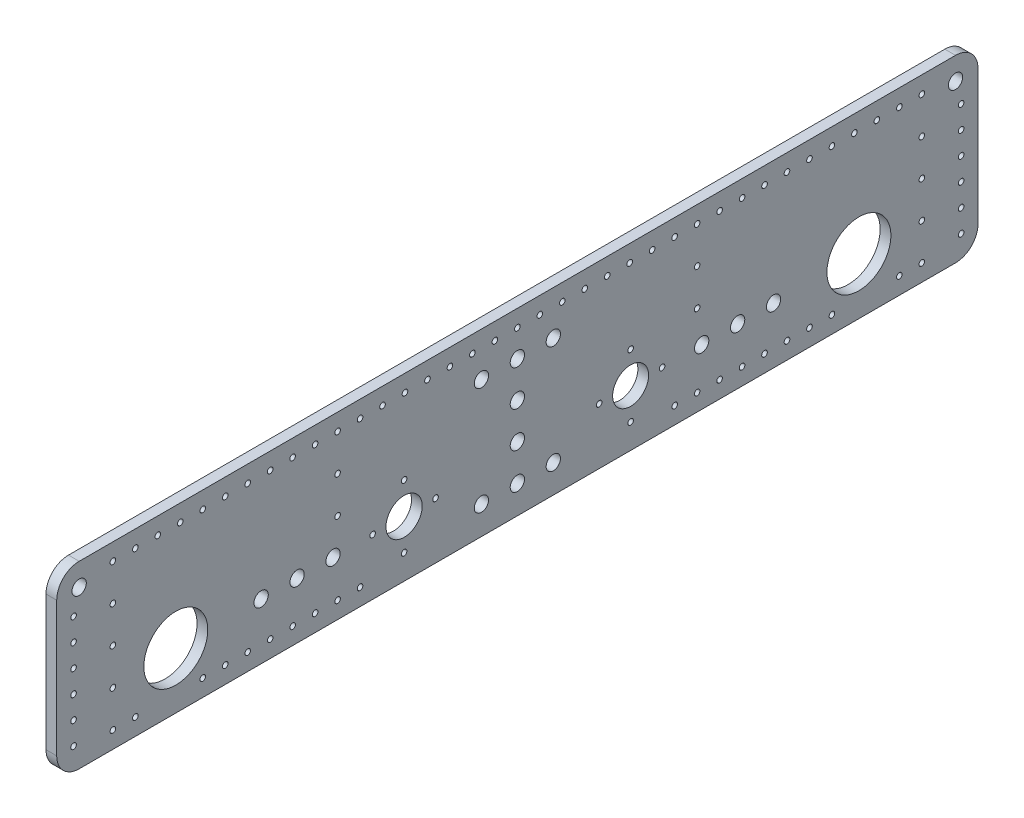
from build123d import *

# Parameters (mm, degrees)
SKETCH2_R           = 14.225
SKETCH2_R_2         = 3.18
SKETCH2_R_3         = 1.25
SKETCH2_R_4         = 8
SKETCH2_R_5         = 8.068284678
BOSS_EXTRUDE1_DEPTH = 4.7625


with BuildPart() as part:
    # Sketch2 → Boss-Extrude1 (new body)
    with BuildSketch(Plane(origin=(0, 0, 0), x_dir=(0, 0, -1), z_dir=(1, 0, 0))):
        with BuildLine():
            Line((-23.472321429, 28.668303571), (-23.472321429, -31.331696429))
            ThreePointArc((-23.472321429, -31.331696429), (-20.54338924, -38.40276424), (-13.472321429, -41.331696429))
            Line((-13.472321429, -41.331696429), (376.527678571, -41.331696429))
            ThreePointArc((376.527678571, -41.331696429), (383.598746383, -38.40276424), (386.527678571, -31.331696429))
            Line((386.527678571, -31.331696429), (386.527678571, 28.668303571))
            ThreePointArc((386.527678571, 28.668303571), (383.598746383, 35.739371383), (376.527678571, 38.668303571))
            Line((376.527678571, 38.668303571), (-13.472321429, 38.668303571))
            ThreePointArc((-13.472321429, 38.668303571), (-20.54338924, 35.739371383), (-23.472321429, 28.668303571))
        make_face()
        with Locations((29.527678571, -16.331696429)):
            Circle(SKETCH2_R, mode=Mode.SUBTRACT)
        with Locations((333.527678571, -16.331696429)):
            Circle(SKETCH2_R, mode=Mode.SUBTRACT)
        with Locations((181.527678571, -28.771696429)):
            Circle(SKETCH2_R_2, mode=Mode.SUBTRACT)
        with Locations((197.527678571, -28.771696429)):
            Circle(SKETCH2_R_2, mode=Mode.SUBTRACT)
        with Locations((197.527678571, 19.228303571)):
            Circle(SKETCH2_R_2, mode=Mode.SUBTRACT)
        with Locations((181.527678571, -12.771696429)):
            Circle(SKETCH2_R_2, mode=Mode.SUBTRACT)
        with Locations((181.527678571, 3.228303571)):
            Circle(SKETCH2_R_2, mode=Mode.SUBTRACT)
        with Locations((181.527678571, 19.228303571)):
            Circle(SKETCH2_R_2, mode=Mode.SUBTRACT)
        with Locations((165.527678571, -28.771696429)):
            Circle(SKETCH2_R_2, mode=Mode.SUBTRACT)
        with Locations((165.527678571, 19.228303571)):
            Circle(SKETCH2_R_2, mode=Mode.SUBTRACT)
        with Locations((83.502678571, -16.331696429)):
            Circle(SKETCH2_R_2, mode=Mode.SUBTRACT)
        with Locations((279.552678571, -16.331696429)):
            Circle(SKETCH2_R_2, mode=Mode.SUBTRACT)
        with Locations((1.527678571, 31.168303571)):
            Circle(SKETCH2_R_3, mode=Mode.SUBTRACT)
        with Locations((11.527678571, 31.168303571)):
            Circle(SKETCH2_R_3, mode=Mode.SUBTRACT)
        with Locations((21.527678571, 31.168303571)):
            Circle(SKETCH2_R_3, mode=Mode.SUBTRACT)
        with Locations((31.527678571, 31.168303571)):
            Circle(SKETCH2_R_3, mode=Mode.SUBTRACT)
        with Locations((41.527678571, 31.168303571)):
            Circle(SKETCH2_R_3, mode=Mode.SUBTRACT)
        with Locations((51.527678571, 31.168303571)):
            Circle(SKETCH2_R_3, mode=Mode.SUBTRACT)
        with Locations((61.527678571, 31.168303571)):
            Circle(SKETCH2_R_3, mode=Mode.SUBTRACT)
        with Locations((71.527678571, 31.168303571)):
            Circle(SKETCH2_R_3, mode=Mode.SUBTRACT)
        with Locations((81.527678571, 31.168303571)):
            Circle(SKETCH2_R_3, mode=Mode.SUBTRACT)
        with Locations((91.527678571, 31.168303571)):
            Circle(SKETCH2_R_3, mode=Mode.SUBTRACT)
        with Locations((101.527678571, 31.168303571)):
            Circle(SKETCH2_R_3, mode=Mode.SUBTRACT)
        with Locations((111.527678571, 31.168303571)):
            Circle(SKETCH2_R_3, mode=Mode.SUBTRACT)
        with Locations((121.527678571, 31.168303571)):
            Circle(SKETCH2_R_3, mode=Mode.SUBTRACT)
        with Locations((131.527678571, 31.168303571)):
            Circle(SKETCH2_R_3, mode=Mode.SUBTRACT)
        with Locations((141.527678571, 31.168303571)):
            Circle(SKETCH2_R_3, mode=Mode.SUBTRACT)
        with Locations((151.527678571, 31.168303571)):
            Circle(SKETCH2_R_3, mode=Mode.SUBTRACT)
        with Locations((161.527678571, 31.168303571)):
            Circle(SKETCH2_R_3, mode=Mode.SUBTRACT)
        with Locations((171.527678571, 31.168303571)):
            Circle(SKETCH2_R_3, mode=Mode.SUBTRACT)
        with Locations((181.527678571, 31.168303571)):
            Circle(SKETCH2_R_3, mode=Mode.SUBTRACT)
        with Locations((191.527678571, 31.168303571)):
            Circle(SKETCH2_R_3, mode=Mode.SUBTRACT)
        with Locations((201.527678571, 31.168303571)):
            Circle(SKETCH2_R_3, mode=Mode.SUBTRACT)
        with Locations((211.527678571, 31.168303571)):
            Circle(SKETCH2_R_3, mode=Mode.SUBTRACT)
        with Locations((221.527678571, 31.168303571)):
            Circle(SKETCH2_R_3, mode=Mode.SUBTRACT)
        with Locations((231.527678571, 31.168303571)):
            Circle(SKETCH2_R_3, mode=Mode.SUBTRACT)
        with Locations((241.527678571, 31.168303571)):
            Circle(SKETCH2_R_3, mode=Mode.SUBTRACT)
        with Locations((251.527678571, 31.168303571)):
            Circle(SKETCH2_R_3, mode=Mode.SUBTRACT)
        with Locations((261.527678571, 31.168303571)):
            Circle(SKETCH2_R_3, mode=Mode.SUBTRACT)
        with Locations((271.527678571, 31.168303571)):
            Circle(SKETCH2_R_3, mode=Mode.SUBTRACT)
        with Locations((281.527678571, 31.168303571)):
            Circle(SKETCH2_R_3, mode=Mode.SUBTRACT)
        with Locations((291.527678571, 31.168303571)):
            Circle(SKETCH2_R_3, mode=Mode.SUBTRACT)
        with Locations((301.527678571, 31.168303571)):
            Circle(SKETCH2_R_3, mode=Mode.SUBTRACT)
        with Locations((311.527678571, 31.168303571)):
            Circle(SKETCH2_R_3, mode=Mode.SUBTRACT)
        with Locations((321.527678571, 31.168303571)):
            Circle(SKETCH2_R_3, mode=Mode.SUBTRACT)
        with Locations((331.527678571, 31.168303571)):
            Circle(SKETCH2_R_3, mode=Mode.SUBTRACT)
        with Locations((341.527678571, 31.168303571)):
            Circle(SKETCH2_R_3, mode=Mode.SUBTRACT)
        with Locations((351.527678571, 31.168303571)):
            Circle(SKETCH2_R_3, mode=Mode.SUBTRACT)
        with Locations((361.527678571, 31.168303571)):
            Circle(SKETCH2_R_3, mode=Mode.SUBTRACT)
        with Locations((1.527678571, -33.831696429)):
            Circle(SKETCH2_R_3, mode=Mode.SUBTRACT)
        with Locations((11.527678571, -33.831696429)):
            Circle(SKETCH2_R_3, mode=Mode.SUBTRACT)
        with Locations((41.527678571, -33.831696429)):
            Circle(SKETCH2_R_3, mode=Mode.SUBTRACT)
        with Locations((51.527678571, -33.831696429)):
            Circle(SKETCH2_R_3, mode=Mode.SUBTRACT)
        with Locations((61.527678571, -33.831696429)):
            Circle(SKETCH2_R_3, mode=Mode.SUBTRACT)
        with Locations((71.527678571, -33.831696429)):
            Circle(SKETCH2_R_3, mode=Mode.SUBTRACT)
        with Locations((81.527678571, -33.831696429)):
            Circle(SKETCH2_R_3, mode=Mode.SUBTRACT)
        with Locations((91.527678571, -33.831696429)):
            Circle(SKETCH2_R_3, mode=Mode.SUBTRACT)
        with Locations((101.527678571, -33.831696429)):
            Circle(SKETCH2_R_3, mode=Mode.SUBTRACT)
        with Locations((111.527678571, -33.831696429)):
            Circle(SKETCH2_R_3, mode=Mode.SUBTRACT)
        with Locations((251.527678571, -33.831696429)):
            Circle(SKETCH2_R_3, mode=Mode.SUBTRACT)
        with Locations((261.527678571, -33.831696429)):
            Circle(SKETCH2_R_3, mode=Mode.SUBTRACT)
        with Locations((271.527678571, -33.831696429)):
            Circle(SKETCH2_R_3, mode=Mode.SUBTRACT)
        with Locations((281.527678571, -33.831696429)):
            Circle(SKETCH2_R_3, mode=Mode.SUBTRACT)
        with Locations((291.527678571, -33.831696429)):
            Circle(SKETCH2_R_3, mode=Mode.SUBTRACT)
        with Locations((301.527678571, -33.831696429)):
            Circle(SKETCH2_R_3, mode=Mode.SUBTRACT)
        with Locations((311.527678571, -33.831696429)):
            Circle(SKETCH2_R_3, mode=Mode.SUBTRACT)
        with Locations((321.527678571, -33.831696429)):
            Circle(SKETCH2_R_3, mode=Mode.SUBTRACT)
        with Locations((351.527678571, -33.831696429)):
            Circle(SKETCH2_R_3, mode=Mode.SUBTRACT)
        with Locations((361.527678571, -33.831696429)):
            Circle(SKETCH2_R_3, mode=Mode.SUBTRACT)
        with Locations((-13.472321429, 28.668303571)):
            Circle(SKETCH2_R_2, mode=Mode.SUBTRACT)
        with Locations((376.527678571, 28.668303571)):
            Circle(SKETCH2_R_2, mode=Mode.SUBTRACT)
        with Locations((295.552678571, -16.331696429)):
            Circle(SKETCH2_R_2, mode=Mode.SUBTRACT)
        with Locations((67.502678571, -16.331696429)):
            Circle(SKETCH2_R_2, mode=Mode.SUBTRACT)
        with Locations((263.552678571, -16.331696429)):
            Circle(SKETCH2_R_2, mode=Mode.SUBTRACT)
        with Locations((131.127678571, -30.331696429)):
            Circle(SKETCH2_R_3, mode=Mode.SUBTRACT)
        with Locations((145.127678571, -16.331696429)):
            Circle(SKETCH2_R_3, mode=Mode.SUBTRACT)
        with Locations((131.127678571, -2.331696429)):
            Circle(SKETCH2_R_3, mode=Mode.SUBTRACT)
        with Locations((117.127678571, -16.331696429)):
            Circle(SKETCH2_R_3, mode=Mode.SUBTRACT)
        with Locations((231.927678571, -30.331696429)):
            Circle(SKETCH2_R_3, mode=Mode.SUBTRACT)
        with Locations((217.927678571, -16.331696429)):
            Circle(SKETCH2_R_3, mode=Mode.SUBTRACT)
        with Locations((231.927678571, -2.331696429)):
            Circle(SKETCH2_R_3, mode=Mode.SUBTRACT)
        with Locations((245.927678571, -16.331696429)):
            Circle(SKETCH2_R_3, mode=Mode.SUBTRACT)
        with Locations((231.927678571, -16.331696429)):
            Circle(SKETCH2_R_4, mode=Mode.SUBTRACT)
        with Locations((131.127678571, -16.331696429)):
            Circle(SKETCH2_R_5, mode=Mode.SUBTRACT)
        with Locations((-15.972321429, 18.668303571)):
            Circle(SKETCH2_R_3, mode=Mode.SUBTRACT)
        with Locations((379.027678571, 18.668303571)):
            Circle(SKETCH2_R_3, mode=Mode.SUBTRACT)
        with Locations((379.027678571, 8.668303571)):
            Circle(SKETCH2_R_3, mode=Mode.SUBTRACT)
        with Locations((379.027678571, -1.331696429)):
            Circle(SKETCH2_R_3, mode=Mode.SUBTRACT)
        with Locations((379.027678571, -11.331696429)):
            Circle(SKETCH2_R_3, mode=Mode.SUBTRACT)
        with Locations((379.027678571, -21.331696429)):
            Circle(SKETCH2_R_3, mode=Mode.SUBTRACT)
        with Locations((379.027678571, -31.331696429)):
            Circle(SKETCH2_R_3, mode=Mode.SUBTRACT)
        with Locations((-15.972321429, 8.668303571)):
            Circle(SKETCH2_R_3, mode=Mode.SUBTRACT)
        with Locations((-15.972321429, -1.331696429)):
            Circle(SKETCH2_R_3, mode=Mode.SUBTRACT)
        with Locations((-15.972321429, -11.331696429)):
            Circle(SKETCH2_R_3, mode=Mode.SUBTRACT)
        with Locations((-15.972321429, -21.331696429)):
            Circle(SKETCH2_R_3, mode=Mode.SUBTRACT)
        with Locations((-15.972321429, -31.331696429)):
            Circle(SKETCH2_R_3, mode=Mode.SUBTRACT)
        with Locations((101.527678571, -1.331696429)):
            Circle(SKETCH2_R_3, mode=Mode.SUBTRACT)
        with Locations((101.527678571, 14.918303571)):
            Circle(SKETCH2_R_3, mode=Mode.SUBTRACT)
        with Locations((361.527678571, -17.581696429)):
            Circle(SKETCH2_R_3, mode=Mode.SUBTRACT)
        with Locations((361.527678571, -1.331696429)):
            Circle(SKETCH2_R_3, mode=Mode.SUBTRACT)
        with Locations((361.527678571, 14.918303571)):
            Circle(SKETCH2_R_3, mode=Mode.SUBTRACT)
        with Locations((1.527678571, -17.581696429)):
            Circle(SKETCH2_R_3, mode=Mode.SUBTRACT)
        with Locations((1.527678571, -1.331696429)):
            Circle(SKETCH2_R_3, mode=Mode.SUBTRACT)
        with Locations((1.527678571, 14.918303571)):
            Circle(SKETCH2_R_3, mode=Mode.SUBTRACT)
        with Locations((99.502678571, -16.331696429)):
            Circle(SKETCH2_R_2, mode=Mode.SUBTRACT)
        with Locations((261.527678571, -1.331696429)):
            Circle(SKETCH2_R_3, mode=Mode.SUBTRACT)
        with Locations((261.527678571, 14.918303571)):
            Circle(SKETCH2_R_3, mode=Mode.SUBTRACT)
    extrude(amount=BOSS_EXTRUDE1_DEPTH)


solid = part.part
